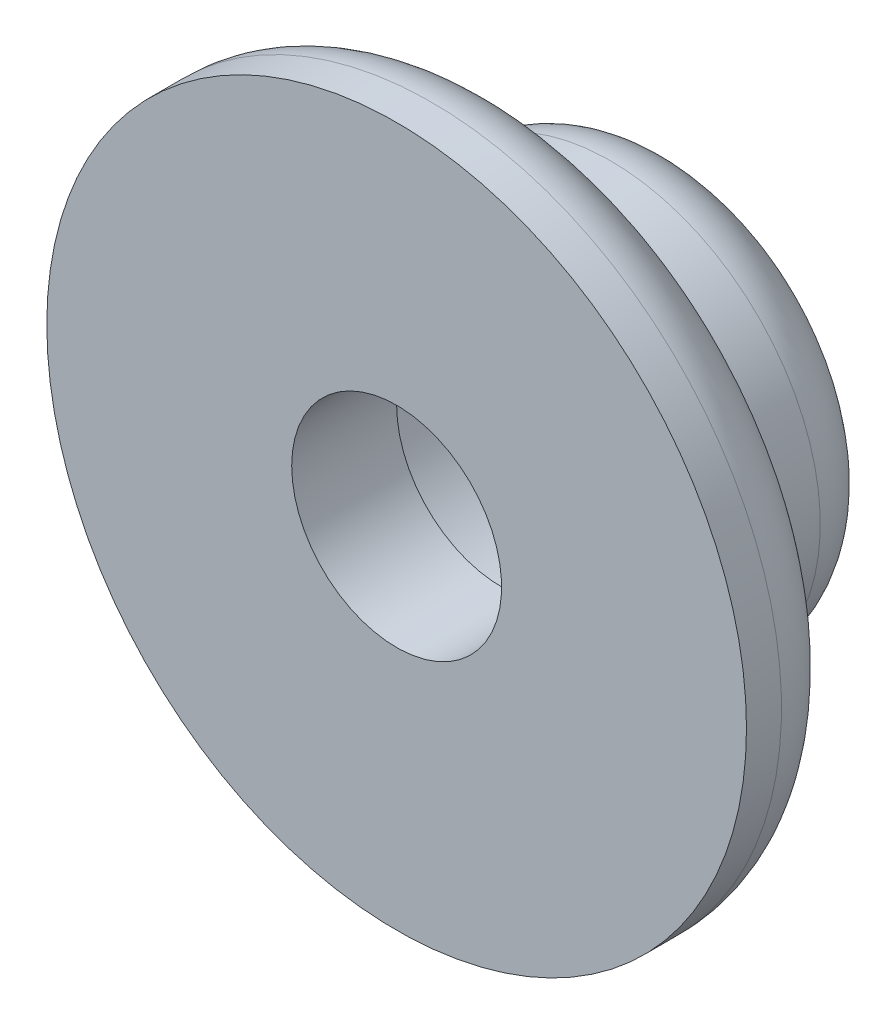
from build123d import *

# Parameters (mm, degrees)
SKETCH_1_R          = 10
EXTRUDE_1_DEPTH     = 8
SKETCH_2_R          = 4.15
CUT_EXTRUDE_1_DEPTH = 5
SKETCH_3_R          = 11.188676277
SKETCH_3_R_2        = 6
CUT_EXTRUDE_2_DEPTH = 5
FILLET_1_R          = 0.5
FILLET_2_R          = 2
SKETCH_4_R          = 3
CUT_EXTRUDE_3_DEPTH = 16


with BuildPart() as part:
    # 草图1 → 凸台-拉伸1 (new body)
    with BuildSketch(Plane.XY):
        Circle(SKETCH_1_R)
    extrude(amount=EXTRUDE_1_DEPTH)

    # 草图2 → 切除-拉伸1 (cut)
    with BuildSketch(Plane(origin=(0, 0, 0), x_dir=(-1, 0, 0), z_dir=(0, 0, -1))):
        Circle(SKETCH_2_R)
    extrude(amount=-CUT_EXTRUDE_1_DEPTH, mode=Mode.SUBTRACT)

    # 草图3 → 切除-拉伸2 (cut)
    with BuildSketch(Plane(origin=(0, 0, 0), x_dir=(-1, 0, 0), z_dir=(0, 0, -1))):
        Circle(SKETCH_3_R)
        Circle(SKETCH_3_R_2, mode=Mode.SUBTRACT)
    extrude(amount=-CUT_EXTRUDE_2_DEPTH, mode=Mode.SUBTRACT)

    # 圆角1
    fillet_1_edges = [part.edges().sort_by_distance(p)[0] for p in [
        (4.15, 0, 0),
    ]]
    fillet(fillet_1_edges, radius=FILLET_1_R)

    # 圆角2
    # the kernel refuses this fillet: 2 mm, written as the material it takes off along each edge
    with BuildSketch(Plane(origin=(0, 0, 5), x_dir=(1, 0, 0), z_dir=(0, 1, 0))) as fillet_2_piece_1:
        with BuildLine():
            CenterArc((10 - FILLET_2_R, -FILLET_2_R), FILLET_2_R, 0, 90)
            Line((10, -FILLET_2_R), (10, 0))
            Line((10, 0), (10 - FILLET_2_R, 0))
        make_face()
    revolve(axis=Axis((0, 0, 5), (0, 0, -1)), mode=Mode.SUBTRACT)
    with BuildSketch(Plane(origin=(0, 0, 0), x_dir=(-1, 0, 0), z_dir=(0, -1, 0))) as fillet_2_piece_2:
        with BuildLine():
            CenterArc((4, -1.891428032), FILLET_2_R, 0, 71.034425011)
            Line((6, -1.891428032), (6, 0))
            Line((6, 0), (4.65, 0))
        make_face()
    revolve(axis=Axis((0, 0, 0), (0, 0, -1)), mode=Mode.SUBTRACT)

    # 草图4 → 切除-拉伸3 (cut, through all)
    with BuildSketch(Plane(origin=(0, 0, 5), x_dir=(-1, 0, 0), z_dir=(0, 0, -1))):
        Circle(SKETCH_4_R)
    extrude(amount=-CUT_EXTRUDE_3_DEPTH, mode=Mode.SUBTRACT)


solid = part.part
